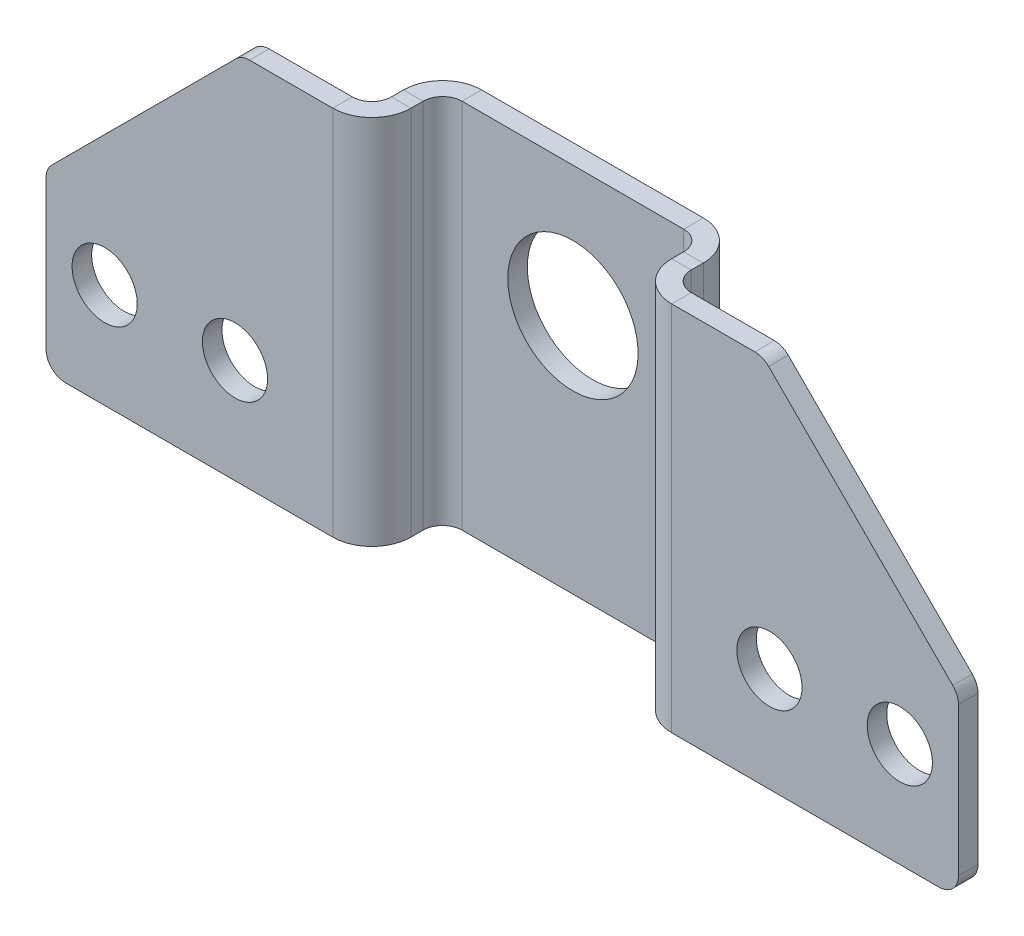
from build123d import *

# Parameters (mm, degrees)
BASE_FLANGE1_DEPTH             = 57
EDGE_FLANGE1_STRIP_W           = 18
EDGE_FLANGE1_STRIP_H           = 3
EDGE_FLANGE1_STRIP_CUT_DEPTH   = 57
EDGE_FLANGE1_STRIP_2_W         = 18
EDGE_FLANGE1_STRIP_2_H         = 3
EDGE_FLANGE1_STRIP_CUT_2_DEPTH = 57
EDGE_FLANGE1_DEPTH             = 57
EDGE_FLANGE1_BEND_DEPTH        = 57
CUT_EXTRUDE1_REACH             = 93.328
SKETCH12_R                     = 10
CHAMFER1_SIZE                  = 30
CUT_EXTRUDE2_REACH             = 92.922
SKETCH13_R                     = 5
FILLET1_R                      = 3


# Sheet-metal steps are written as plain solids
with BuildPart() as part:
    # Sketch1 → Base-Flange1 (new body)
    with BuildSketch(Plane(origin=(0, 0, 0), x_dir=(1, 0, 0), z_dir=(0, 1, 0))):
        with BuildLine():
            Line((-20, 0), (-20, 7.85))
            ThreePointArc((-20, 7.85), (-19.121320344, 9.971320344), (-17, 10.85))
            Line((-17, 10.85), (17, 10.85))
            ThreePointArc((17, 10.85), (19.121320344, 9.971320344), (20, 7.85))
            Line((20, 7.85), (20, 0))
            Line((20, 0), (23, 0))
            Line((23, 0), (23, 7.85))
            ThreePointArc((23, 7.85), (21.242640687, 12.092640687), (17, 13.85))
            Line((17, 13.85), (-17, 13.85))
            ThreePointArc((-17, 13.85), (-21.242640687, 12.092640687), (-23, 7.85))
            Line((-23, 7.85), (-23, 0))
            Line((-23, 0), (-20, 0))
        make_face()
    extrude(amount=BASE_FLANGE1_DEPTH)

    # Edge-Flange1 strip (across the edge) → Edge-Flange1 strip cut (cut)
    with BuildSketch(Plane(origin=(23, 57, 0), x_dir=(0, 0, -1), z_dir=(0, -1, 0))):
        with Locations((-3, -1.5)):
            Rectangle(EDGE_FLANGE1_STRIP_W, EDGE_FLANGE1_STRIP_H)
    extrude(amount=EDGE_FLANGE1_STRIP_CUT_DEPTH, mode=Mode.SUBTRACT)

    # Edge-Flange1 strip 2 (across the edge) → Edge-Flange1 strip cut 2 (cut)
    with BuildSketch(Plane(origin=(-23, 0, 0), x_dir=(0, 0, -1), z_dir=(0, 1, 0))):
        with Locations((-3, -1.5)):
            Rectangle(EDGE_FLANGE1_STRIP_2_W, EDGE_FLANGE1_STRIP_2_H)
    extrude(amount=EDGE_FLANGE1_STRIP_CUT_2_DEPTH, mode=Mode.SUBTRACT)

    # Edge-Flange1 section (across the edge) → Edge-Flange1 (add)
    with BuildSketch(Plane(origin=(23, 57, 0), x_dir=(0, 0, -1), z_dir=(0, -1, 0))):
        with BuildLine():
            Line((0, 3), (0, 47))
            Line((0, 47), (3, 47))
            Line((3, 47), (3, 3))
            ThreePointArc((3, 3), (3.878679656, 0.878679656), (6, 0))
            Line((6, 0), (6, -3))
            ThreePointArc((6, -3), (1.757359313, -1.242640687), (0, 3))
        make_face()
    extrude(amount=EDGE_FLANGE1_DEPTH)

    # Edge-Flange1 section 2 (across the edge) → Edge-Flange1 bend (add)
    with BuildSketch(Plane(origin=(-23, 0, 0), x_dir=(0, 0, -1), z_dir=(0, 1, 0))):
        with BuildLine():
            Line((0, 3), (0, 47))
            Line((0, 47), (3, 47))
            Line((3, 47), (3, 3))
            ThreePointArc((3, 3), (3.878679656, 0.878679656), (6, 0))
            Line((6, 0), (6, -3))
            ThreePointArc((6, -3), (1.757359313, -1.242640687), (0, 3))
        make_face()
    extrude(amount=EDGE_FLANGE1_BEND_DEPTH)

    # Sketch12 → Cut-Extrude1 (cut, up to next)
    with BuildSketch(Plane(origin=(0, 0, -13.85), x_dir=(-1, 0, 0), z_dir=(0, 0, -1)), mode=Mode.PRIVATE) as cut_extrude1_sk1:
        with Locations((0, 37)):
            Circle(SKETCH12_R)
    cut_extrude1_tool1 = extrude(cut_extrude1_sk1.sketch, amount=-CUT_EXTRUDE1_REACH, mode=Mode.PRIVATE) & part.part
    add(cut_extrude1_tool1.solids().sort_by_distance((0, 37, -13.85))[0], mode=Mode.SUBTRACT)

    # Chamfer1
    chamfer1_edges = [part.edges().sort_by_distance(p)[0] for p in [
        (70, 57, -1.5),
        (-70, 57, -1.5),
    ]]
    chamfer(chamfer1_edges, length=CHAMFER1_SIZE)

    # Sketch13 → Cut-Extrude2 (cut, up to next)
    with BuildSketch(Plane(origin=(0, 0, -3), x_dir=(-1, 0, 0), z_dir=(0, 0, -1)), mode=Mode.PRIVATE) as cut_extrude2_sk1:
        with Locations((-61, 16)):
            Circle(SKETCH13_R)
    cut_extrude2_tool1 = extrude(cut_extrude2_sk1.sketch, amount=-CUT_EXTRUDE2_REACH, mode=Mode.PRIVATE) & part.part
    # Sketch13 → Cut-Extrude2 (cut, up to next)
    with BuildSketch(Plane(origin=(0, 0, -3), x_dir=(-1, 0, 0), z_dir=(0, 0, -1)), mode=Mode.PRIVATE) as cut_extrude2_sk2:
        with Locations((-41, 16)):
            Circle(SKETCH13_R)
    cut_extrude2_tool2 = extrude(cut_extrude2_sk2.sketch, amount=-CUT_EXTRUDE2_REACH, mode=Mode.PRIVATE) & part.part
    # Sketch13 → Cut-Extrude2 (cut, up to next)
    with BuildSketch(Plane(origin=(0, 0, -3), x_dir=(-1, 0, 0), z_dir=(0, 0, -1)), mode=Mode.PRIVATE) as cut_extrude2_sk3:
        with Locations((41, 16)):
            Circle(SKETCH13_R)
    cut_extrude2_tool3 = extrude(cut_extrude2_sk3.sketch, amount=-CUT_EXTRUDE2_REACH, mode=Mode.PRIVATE) & part.part
    # Sketch13 → Cut-Extrude2 (cut, up to next)
    with BuildSketch(Plane(origin=(0, 0, -3), x_dir=(-1, 0, 0), z_dir=(0, 0, -1)), mode=Mode.PRIVATE) as cut_extrude2_sk4:
        with Locations((61, 16)):
            Circle(SKETCH13_R)
    cut_extrude2_tool4 = extrude(cut_extrude2_sk4.sketch, amount=-CUT_EXTRUDE2_REACH, mode=Mode.PRIVATE) & part.part
    add(cut_extrude2_tool1.solids().sort_by_distance((61, 16, -3))[0], mode=Mode.SUBTRACT)
    add(cut_extrude2_tool2.solids().sort_by_distance((41, 16, -3))[0], mode=Mode.SUBTRACT)
    add(cut_extrude2_tool3.solids().sort_by_distance((-41, 16, -3))[0], mode=Mode.SUBTRACT)
    add(cut_extrude2_tool4.solids().sort_by_distance((-61, 16, -3))[0], mode=Mode.SUBTRACT)

    # Fillet1
    fillet1_edges = [part.edges().sort_by_distance(p)[0] for p in [
        (-70, 27, -1.5),
        (-40, 57, -1.5),
        (40, 57, -1.5),
        (70, 27, -1.5),
        (70, 0, -1.5),
        (-70, 0, -1.5),
    ]]
    fillet(fillet1_edges, radius=FILLET1_R)


solid = part.part
